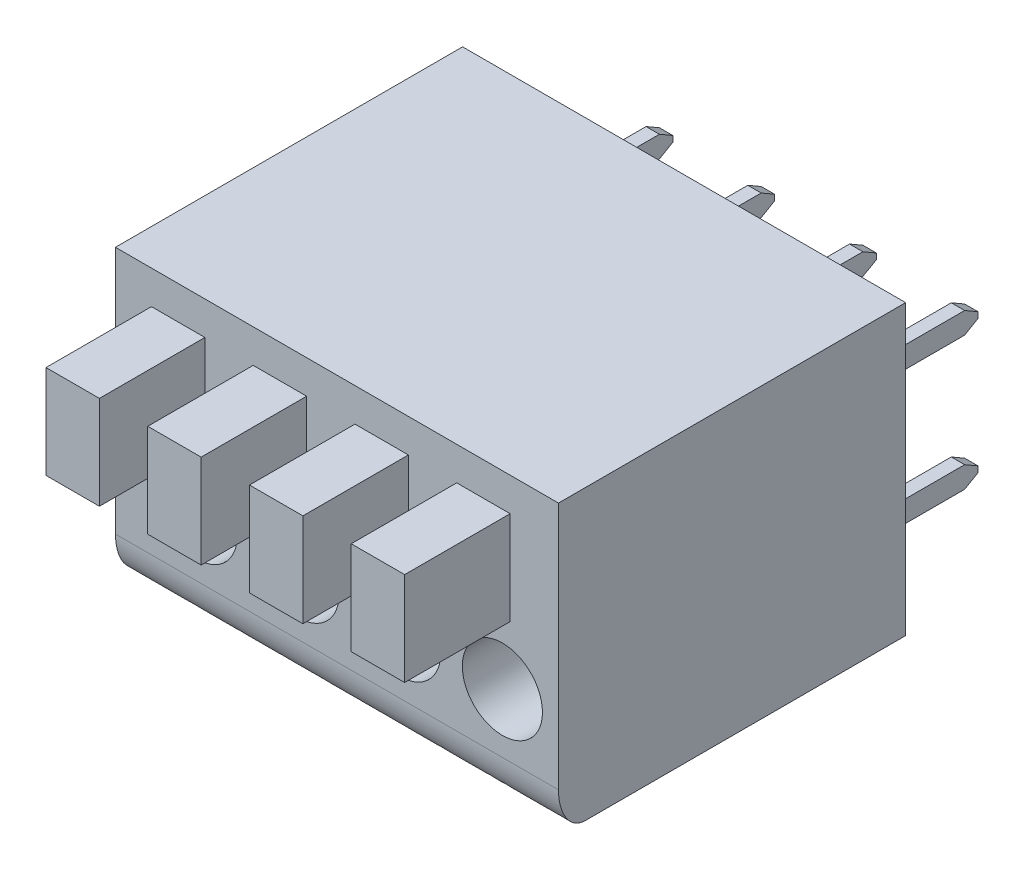
from build123d import *
from OCP.BRepFilletAPI import BRepFilletAPI_MakeChamfer

# Parameters (mm, degrees)
SKETCH_1_W                          = 16.59
SKETCH_1_H                          = 10.8
EXTRUDE_1_DEPTH                     = 13
FILLET_1_SIZE                       = 1
FILLET_1_SIZE_2                     = 1.5
SKETCH_2_W                          = 2
SKETCH_2_H                          = 3.5
EXTRUDE_2_DEPTH                     = 3.95
SKETCH_3_R                          = 1.5
CUT_EXTRUDE_1_DEPTH                 = 3.95
SKETCH_4_W                          = 0.5
SKETCH_4_H                          = 0.8
EXTRUDE_3_DEPTH                     = 3.5
CHAMFER_1_SIZE                      = 0.5
CHAMFER_1_SIZE2                     = 0.288675135
PATTERN_LINEAR_2_COUNT              = 4
PATTERN_LINEAR_2_PITCH              = 3.81
CHAMFER_1_OF_PATTERN_LINEAR_2_SIZE  = 0.5
CHAMFER_1_OF_PATTERN_LINEAR_2_SIZE2 = 0.288675135


with BuildPart() as part:
    # Эскиз1 → Бобышка-Вытянуть1 (new body)
    with BuildSketch(Plane.XY):
        Rectangle(SKETCH_1_W, SKETCH_1_H)
    extrude(amount=EXTRUDE_1_DEPTH)

    # Скругление1
    # an asymmetric fillet: 1.5, 1 mm, written as the material it takes off along each edge
    with BuildSketch(Plane(origin=(-12.045, -5.4, 13), x_dir=(0, 0, -1), z_dir=(1, 0, 0))) as fillet_1_piece_1:
        with BuildLine():
            Bezier((FILLET_1_SIZE, 0), (0, 0), (0, FILLET_1_SIZE_2), weights=[1, 0.707106781, 1])
            Line((0, FILLET_1_SIZE_2), (0, 0))
            Line((0, 0), (FILLET_1_SIZE, 0))
        make_face()
    extrude(amount=24.09, mode=Mode.SUBTRACT)

    # Эскиз2 → Бобышка-Вытянуть2 (add)
    with BuildSketch(Plane.XY.offset(13)):
        with Locations((5.485, 2.4)):
            Rectangle(SKETCH_2_W, SKETCH_2_H)
    extrude_2 = extrude(amount=EXTRUDE_2_DEPTH)

    # Эскиз3 → Вырез-Вытянуть1 (cut)
    with BuildSketch(Plane.XY.offset(13)):
        with Locations((6.195, -1.686021073)):
            Circle(SKETCH_3_R)
    cut_extrude_1 = extrude(amount=-CUT_EXTRUDE_1_DEPTH, mode=Mode.SUBTRACT)

    # Эскиз4 → Бобышка-Вытянуть3 (add)
    with BuildSketch(Plane(origin=(0, 0, 0), x_dir=(-1, 0, 0), z_dir=(0, 0, -1))):
        with Locations((-7.255, 2.85)):
            Rectangle(SKETCH_4_W, SKETCH_4_H)
        with Locations((-7.255, -2.15)):
            Rectangle(SKETCH_4_W, SKETCH_4_H)
    extrude_3 = extrude(amount=EXTRUDE_3_DEPTH)

    # Фаска1: one chamfer whose edges measure the first distance from different faces: ONE call of the kernel's chamfer builder (chamfer() names one face for all edges)
    chamfer_1_edges_1 = [part.edges().sort_by_distance(p)[0] for p in [
        (7.255, 3.25, -3.5),
    ]]
    chamfer_1_side_1 = [part.faces().sort_by_distance(p)[0] for p in [
        (7.255, 3.25, -1.75),
    ]]
    chamfer_1_edges_2 = [part.edges().sort_by_distance(p)[0] for p in [
        (7.255, 2.45, -3.5),
    ]]
    chamfer_1_side_2 = [part.faces().sort_by_distance(p)[0] for p in [
        (7.255, 2.45, -1.75),
    ]]
    chamfer_1_edges_3 = [part.edges().sort_by_distance(p)[0] for p in [
        (7.255, -2.55, -3.5),
    ]]
    chamfer_1_side_3 = [part.faces().sort_by_distance(p)[0] for p in [
        (7.255, -2.55, -1.75),
    ]]
    chamfer_1_edges_4 = [part.edges().sort_by_distance(p)[0] for p in [
        (7.255, -1.75, -3.5),
    ]]
    chamfer_1_side_4 = [part.faces().sort_by_distance(p)[0] for p in [
        (7.255, -1.75, -1.75),
    ]]
    chamfer_1 = BRepFilletAPI_MakeChamfer(part.part.solid().wrapped)
    for e in chamfer_1_edges_1:
        chamfer_1.Add(CHAMFER_1_SIZE, CHAMFER_1_SIZE2, e.wrapped, chamfer_1_side_1[0].wrapped)  # the first distance lies on this face
    for e in chamfer_1_edges_2:
        chamfer_1.Add(CHAMFER_1_SIZE, CHAMFER_1_SIZE2, e.wrapped, chamfer_1_side_2[0].wrapped)  # the first distance lies on this face
    for e in chamfer_1_edges_3:
        chamfer_1.Add(CHAMFER_1_SIZE, CHAMFER_1_SIZE2, e.wrapped, chamfer_1_side_3[0].wrapped)  # the first distance lies on this face
    for e in chamfer_1_edges_4:
        chamfer_1.Add(CHAMFER_1_SIZE, CHAMFER_1_SIZE2, e.wrapped, chamfer_1_side_4[0].wrapped)  # the first distance lies on this face
    add(Compound.cast(chamfer_1.Shape()), mode=Mode.REPLACE)

    # Линейный массив2: Бобышка-Вытянуть2, Вырез-Вытянуть1, Бобышка-Вытянуть3 ×4
    with Locations(*[(-i * PATTERN_LINEAR_2_PITCH, 0, 0) for i in range(1, PATTERN_LINEAR_2_COUNT)]):
        add(extrude_2)
        add(cut_extrude_1, mode=Mode.SUBTRACT)
        add(extrude_3)

    # Фаска1 of Линейный массив2: one chamfer whose edges measure the first distance from different faces: ONE call of the kernel's chamfer builder (chamfer() names one face for all edges)
    chamfer_1_of_pattern_linear_2_edges_1 = [part.edges().sort_by_distance(p)[0] for p in [
        (3.445, 3.25, -3.5),
    ]]
    chamfer_1_of_pattern_linear_2_side_1 = [part.faces().sort_by_distance(p)[0] for p in [
        (3.445, 3.25, -1.75),
    ]]
    chamfer_1_of_pattern_linear_2_edges_2 = [part.edges().sort_by_distance(p)[0] for p in [
        (3.445, 2.45, -3.5),
    ]]
    chamfer_1_of_pattern_linear_2_side_2 = [part.faces().sort_by_distance(p)[0] for p in [
        (3.445, 2.45, -1.75),
    ]]
    chamfer_1_of_pattern_linear_2_edges_3 = [part.edges().sort_by_distance(p)[0] for p in [
        (3.445, -2.55, -3.5),
    ]]
    chamfer_1_of_pattern_linear_2_side_3 = [part.faces().sort_by_distance(p)[0] for p in [
        (3.445, -2.55, -1.75),
    ]]
    chamfer_1_of_pattern_linear_2_edges_4 = [part.edges().sort_by_distance(p)[0] for p in [
        (3.445, -1.75, -3.5),
    ]]
    chamfer_1_of_pattern_linear_2_side_4 = [part.faces().sort_by_distance(p)[0] for p in [
        (3.445, -1.75, -1.75),
    ]]
    chamfer_1_of_pattern_linear_2_edges_5 = [part.edges().sort_by_distance(p)[0] for p in [
        (-0.365, 3.25, -3.5),
    ]]
    chamfer_1_of_pattern_linear_2_side_5 = [part.faces().sort_by_distance(p)[0] for p in [
        (-0.365, 3.25, -1.75),
    ]]
    chamfer_1_of_pattern_linear_2_edges_6 = [part.edges().sort_by_distance(p)[0] for p in [
        (-0.365, 2.45, -3.5),
    ]]
    chamfer_1_of_pattern_linear_2_side_6 = [part.faces().sort_by_distance(p)[0] for p in [
        (-0.365, 2.45, -1.75),
    ]]
    chamfer_1_of_pattern_linear_2_edges_7 = [part.edges().sort_by_distance(p)[0] for p in [
        (-0.365, -2.55, -3.5),
    ]]
    chamfer_1_of_pattern_linear_2_side_7 = [part.faces().sort_by_distance(p)[0] for p in [
        (-0.365, -2.55, -1.75),
    ]]
    chamfer_1_of_pattern_linear_2_edges_8 = [part.edges().sort_by_distance(p)[0] for p in [
        (-0.365, -1.75, -3.5),
    ]]
    chamfer_1_of_pattern_linear_2_side_8 = [part.faces().sort_by_distance(p)[0] for p in [
        (-0.365, -1.75, -1.75),
    ]]
    chamfer_1_of_pattern_linear_2_edges_9 = [part.edges().sort_by_distance(p)[0] for p in [
        (-4.175, 3.25, -3.5),
    ]]
    chamfer_1_of_pattern_linear_2_side_9 = [part.faces().sort_by_distance(p)[0] for p in [
        (-4.175, 3.25, -1.75),
    ]]
    chamfer_1_of_pattern_linear_2_edges_10 = [part.edges().sort_by_distance(p)[0] for p in [
        (-4.175, 2.45, -3.5),
    ]]
    chamfer_1_of_pattern_linear_2_side_10 = [part.faces().sort_by_distance(p)[0] for p in [
        (-4.175, 2.45, -1.75),
    ]]
    chamfer_1_of_pattern_linear_2_edges_11 = [part.edges().sort_by_distance(p)[0] for p in [
        (-4.175, -2.55, -3.5),
    ]]
    chamfer_1_of_pattern_linear_2_side_11 = [part.faces().sort_by_distance(p)[0] for p in [
        (-4.175, -2.55, -1.75),
    ]]
    chamfer_1_of_pattern_linear_2_edges_12 = [part.edges().sort_by_distance(p)[0] for p in [
        (-4.175, -1.75, -3.5),
    ]]
    chamfer_1_of_pattern_linear_2_side_12 = [part.faces().sort_by_distance(p)[0] for p in [
        (-4.175, -1.75, -1.75),
    ]]
    chamfer_1_of_pattern_linear_2 = BRepFilletAPI_MakeChamfer(part.part.solid().wrapped)
    for e in chamfer_1_of_pattern_linear_2_edges_1:
        chamfer_1_of_pattern_linear_2.Add(CHAMFER_1_OF_PATTERN_LINEAR_2_SIZE, CHAMFER_1_OF_PATTERN_LINEAR_2_SIZE2, e.wrapped, chamfer_1_of_pattern_linear_2_side_1[0].wrapped)  # the first distance lies on this face
    for e in chamfer_1_of_pattern_linear_2_edges_2:
        chamfer_1_of_pattern_linear_2.Add(CHAMFER_1_OF_PATTERN_LINEAR_2_SIZE, CHAMFER_1_OF_PATTERN_LINEAR_2_SIZE2, e.wrapped, chamfer_1_of_pattern_linear_2_side_2[0].wrapped)  # the first distance lies on this face
    for e in chamfer_1_of_pattern_linear_2_edges_3:
        chamfer_1_of_pattern_linear_2.Add(CHAMFER_1_OF_PATTERN_LINEAR_2_SIZE, CHAMFER_1_OF_PATTERN_LINEAR_2_SIZE2, e.wrapped, chamfer_1_of_pattern_linear_2_side_3[0].wrapped)  # the first distance lies on this face
    for e in chamfer_1_of_pattern_linear_2_edges_4:
        chamfer_1_of_pattern_linear_2.Add(CHAMFER_1_OF_PATTERN_LINEAR_2_SIZE, CHAMFER_1_OF_PATTERN_LINEAR_2_SIZE2, e.wrapped, chamfer_1_of_pattern_linear_2_side_4[0].wrapped)  # the first distance lies on this face
    for e in chamfer_1_of_pattern_linear_2_edges_5:
        chamfer_1_of_pattern_linear_2.Add(CHAMFER_1_OF_PATTERN_LINEAR_2_SIZE, CHAMFER_1_OF_PATTERN_LINEAR_2_SIZE2, e.wrapped, chamfer_1_of_pattern_linear_2_side_5[0].wrapped)  # the first distance lies on this face
    for e in chamfer_1_of_pattern_linear_2_edges_6:
        chamfer_1_of_pattern_linear_2.Add(CHAMFER_1_OF_PATTERN_LINEAR_2_SIZE, CHAMFER_1_OF_PATTERN_LINEAR_2_SIZE2, e.wrapped, chamfer_1_of_pattern_linear_2_side_6[0].wrapped)  # the first distance lies on this face
    for e in chamfer_1_of_pattern_linear_2_edges_7:
        chamfer_1_of_pattern_linear_2.Add(CHAMFER_1_OF_PATTERN_LINEAR_2_SIZE, CHAMFER_1_OF_PATTERN_LINEAR_2_SIZE2, e.wrapped, chamfer_1_of_pattern_linear_2_side_7[0].wrapped)  # the first distance lies on this face
    for e in chamfer_1_of_pattern_linear_2_edges_8:
        chamfer_1_of_pattern_linear_2.Add(CHAMFER_1_OF_PATTERN_LINEAR_2_SIZE, CHAMFER_1_OF_PATTERN_LINEAR_2_SIZE2, e.wrapped, chamfer_1_of_pattern_linear_2_side_8[0].wrapped)  # the first distance lies on this face
    for e in chamfer_1_of_pattern_linear_2_edges_9:
        chamfer_1_of_pattern_linear_2.Add(CHAMFER_1_OF_PATTERN_LINEAR_2_SIZE, CHAMFER_1_OF_PATTERN_LINEAR_2_SIZE2, e.wrapped, chamfer_1_of_pattern_linear_2_side_9[0].wrapped)  # the first distance lies on this face
    for e in chamfer_1_of_pattern_linear_2_edges_10:
        chamfer_1_of_pattern_linear_2.Add(CHAMFER_1_OF_PATTERN_LINEAR_2_SIZE, CHAMFER_1_OF_PATTERN_LINEAR_2_SIZE2, e.wrapped, chamfer_1_of_pattern_linear_2_side_10[0].wrapped)  # the first distance lies on this face
    for e in chamfer_1_of_pattern_linear_2_edges_11:
        chamfer_1_of_pattern_linear_2.Add(CHAMFER_1_OF_PATTERN_LINEAR_2_SIZE, CHAMFER_1_OF_PATTERN_LINEAR_2_SIZE2, e.wrapped, chamfer_1_of_pattern_linear_2_side_11[0].wrapped)  # the first distance lies on this face
    for e in chamfer_1_of_pattern_linear_2_edges_12:
        chamfer_1_of_pattern_linear_2.Add(CHAMFER_1_OF_PATTERN_LINEAR_2_SIZE, CHAMFER_1_OF_PATTERN_LINEAR_2_SIZE2, e.wrapped, chamfer_1_of_pattern_linear_2_side_12[0].wrapped)  # the first distance lies on this face
    add(Compound.cast(chamfer_1_of_pattern_linear_2.Shape()), mode=Mode.REPLACE)


solid = part.part
